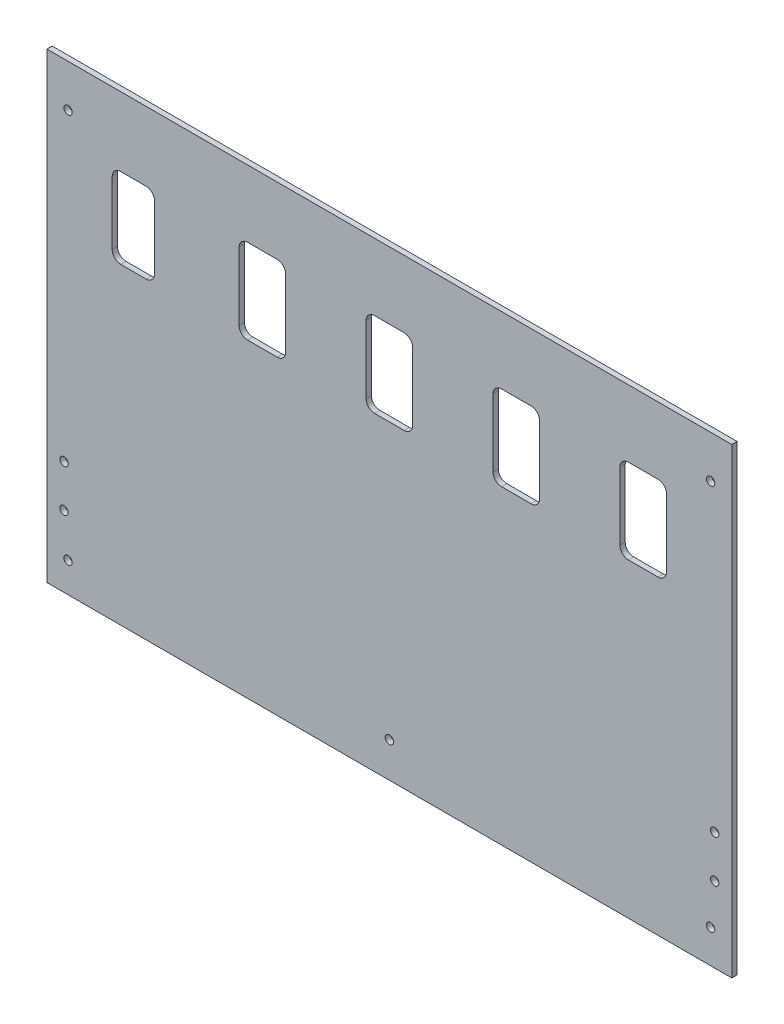
from build123d import *

# Parameters (mm, degrees)
SKETCH3_W              = 411.1625
SKETCH3_H              = 277.368
BOSS_EXTRUDE1_DEPTH    = 1.5875
CUT_EXTRUDE1_DEPTH     = 25.4
F_10_CLEARANCE_HOLE1_D = 4.9784
F_10_CLEARANCE_HOLE2_D = 4.9784
F_10_CLEARANCE_HOLE3_D = 4.9784
F_10_CLEARANCE_HOLE4_D = 4.9784
F_10_CLEARANCE_HOLE5_D = 4.9784


with BuildPart() as part:
    # Sketch3 → Boss-Extrude1 (new, symmetric)
    with BuildSketch(Plane.XY):
        Rectangle(SKETCH3_W, SKETCH3_H)
    extrude(amount=BOSS_EXTRUDE1_DEPTH, both=True)

    # Sketch4 → Cut-Extrude1 (cut)
    with BuildSketch(Plane.XY.offset(1.5875)):
        with BuildLine():
            Line((8.89, 98.4326708), (-8.89, 98.4326708))
            ThreePointArc((-8.89, 98.4326708), (-12.482102448, 96.944773248), (-13.97, 93.3526708))
            Line((-13.97, 93.3526708), (-13.97, 52.7126708))
            ThreePointArc((-13.97, 52.7126708), (-12.482102448, 49.120568352), (-8.89, 47.6326708))
            Line((-8.89, 47.6326708), (8.89, 47.6326708))
            ThreePointArc((8.89, 47.6326708), (12.482102448, 49.120568352), (13.97, 52.7126708))
            Line((13.97, 52.7126708), (13.97, 93.3526708))
            ThreePointArc((13.97, 93.3526708), (12.482102448, 96.944773248), (8.89, 98.4326708))
        make_face()
        with BuildLine():
            Line((85.09, 98.4326708), (67.31, 98.4326708))
            ThreePointArc((67.31, 98.4326708), (63.717897552, 96.944773248), (62.23, 93.3526708))
            Line((62.23, 93.3526708), (62.23, 52.7126708))
            ThreePointArc((62.23, 52.7126708), (63.717897552, 49.120568352), (67.31, 47.6326708))
            Line((67.31, 47.6326708), (85.09, 47.6326708))
            ThreePointArc((85.09, 47.6326708), (88.682102448, 49.120568352), (90.17, 52.7126708))
            Line((90.17, 52.7126708), (90.17, 93.3526708))
            ThreePointArc((90.17, 93.3526708), (88.682102448, 96.944773248), (85.09, 98.4326708))
        make_face()
        with BuildLine():
            Line((161.29, 98.4326708), (143.51, 98.4326708))
            ThreePointArc((143.51, 98.4326708), (139.917897552, 96.944773248), (138.43, 93.3526708))
            Line((138.43, 93.3526708), (138.43, 52.7126708))
            ThreePointArc((138.43, 52.7126708), (139.917897552, 49.120568352), (143.51, 47.6326708))
            Line((143.51, 47.6326708), (161.29, 47.6326708))
            ThreePointArc((161.29, 47.6326708), (164.882102448, 49.120568352), (166.37, 52.7126708))
            Line((166.37, 52.7126708), (166.37, 93.3526708))
            ThreePointArc((166.37, 93.3526708), (164.882102448, 96.944773248), (161.29, 98.4326708))
        make_face()
        with BuildLine():
            Line((-67.31, 98.4326708), (-85.09, 98.4326708))
            ThreePointArc((-85.09, 98.4326708), (-88.682102448, 96.944773248), (-90.17, 93.3526708))
            Line((-90.17, 93.3526708), (-90.17, 52.7126708))
            ThreePointArc((-90.17, 52.7126708), (-88.682102448, 49.120568352), (-85.09, 47.6326708))
            Line((-85.09, 47.6326708), (-67.31, 47.6326708))
            ThreePointArc((-67.31, 47.6326708), (-63.717897552, 49.120568352), (-62.23, 52.7126708))
            Line((-62.23, 52.7126708), (-62.23, 93.3526708))
            ThreePointArc((-62.23, 93.3526708), (-63.717897552, 96.944773248), (-67.31, 98.4326708))
        make_face()
        with BuildLine():
            Line((-146.05, 97.1626708), (-161.29, 97.1626708))
            ThreePointArc((-161.29, 97.1626708), (-164.882102448, 95.674773248), (-166.37, 92.0826708))
            Line((-166.37, 92.0826708), (-166.37, 53.9826708))
            ThreePointArc((-166.37, 53.9826708), (-164.882102448, 50.390568352), (-161.29, 48.9026708))
            Line((-161.29, 48.9026708), (-146.05, 48.9026708))
            ThreePointArc((-146.05, 48.9026708), (-142.457897552, 50.390568352), (-140.97, 53.9826708))
            Line((-140.97, 53.9826708), (-140.97, 92.0826708))
            ThreePointArc((-140.97, 92.0826708), (-142.457897552, 95.674773248), (-146.05, 97.1626708))
        make_face()
    extrude(amount=-CUT_EXTRUDE1_DEPTH, mode=Mode.SUBTRACT)

    # #10 Clearance Hole1 (through all)
    with Locations(Plane.XY.offset(1.5875)):
        with Locations((192.88125, 113.284), (-192.88125, -120.764157335), (192.88125, -118.647541008), (-192.88125, 113.284)):
            Hole(F_10_CLEARANCE_HOLE1_D / 2)

    # #10 Clearance Hole2 (through all)
    with Locations(Plane.XY.offset(1.5875)):
        with Locations((0, -117.532545274)):
            Hole(F_10_CLEARANCE_HOLE2_D / 2)

    # #10 Clearance Hole3 (through all)
    with Locations(Plane.XY.offset(1.5875)):
        with Locations((-195.30625, -70.615668917)):
            Hole(F_10_CLEARANCE_HOLE3_D / 2)

    # #10 Clearance Hole4 (through all)
    with Locations(Plane.XY.offset(1.5875)):
        with Locations((-195.30625, -96.015668917)):
            Hole(F_10_CLEARANCE_HOLE4_D / 2)

    # #10 Clearance Hole5 (through all)
    with Locations(Plane.XY.offset(1.5875)):
        with Locations((195.30625, -68.024189157), (195.30625, -93.424189157)):
            Hole(F_10_CLEARANCE_HOLE5_D / 2)


solid = part.part
